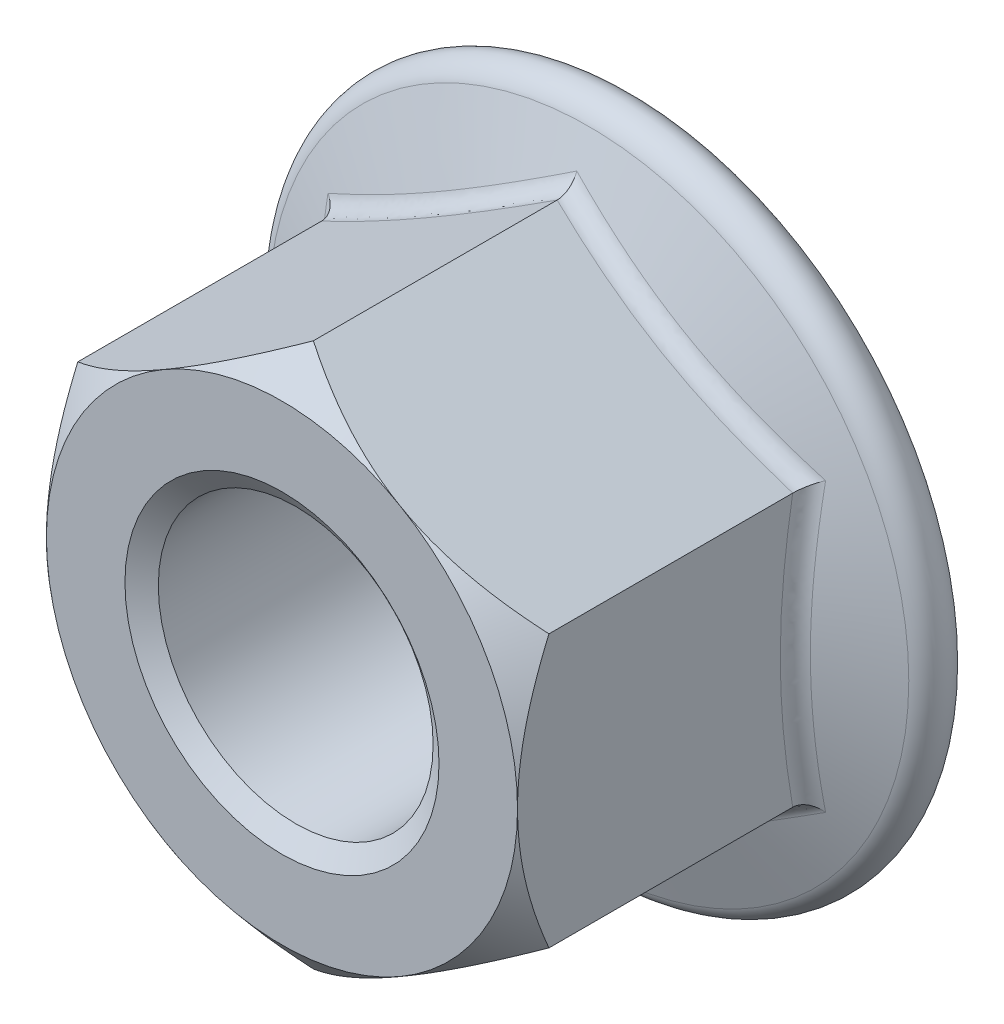
from build123d import *

# Parameters (mm, degrees)
BASENUT_START  = -22.5298
BASENUTSKE_R   = 8.75
BASENUT_DEPTH  = 22.5298
FLANGEFILLET_R = 1.2


# Read off the part's stored shape, not the designer's step: ThreadSchematic
with BuildPart() as part:
    # BaseNutSke → BaseNut (new body)
    with BuildSketch(Plane.XY.offset(BASENUT_START)):
        Polygon((15, 8.660254038), (15, -8.660254038), (0, -17.320508076), (-15, -8.660254038), (-15, 8.660254038), (0, 17.320508076), align=None)
        Circle(BASENUTSKE_R, mode=Mode.SUBTRACT)
    extrude(amount=BASENUT_DEPTH)

    # Sketch5 (on Right Plane) → EndChamfer (revolve, cut)
    with BuildSketch(Plane(origin=(0, 0, 0), x_dir=(0, 0, -1), z_dir=(1, 0, 0)), mode=Mode.PRIVATE) as endchamfer_sk:
        Polygon((22.5044, 10), (21.541614635, 8.625), (22.5552, 8.625), (22.5552, 10), align=None)
    revolve(endchamfer_sk.sketch.rotate(Axis((0, 0, -25.037505729), (0, 0, -1)), 90), axis=Axis((0, 0, -25.037505729), (0, 0, -1)), mode=Mode.SUBTRACT)

    # Sketch6 → Flange (revolve)
    with BuildSketch(Plane(origin=(0, 0, 0), x_dir=(0, 0, -1), z_dir=(1, 0, 0)), mode=Mode.PRIVATE) as flange_sk:
        with BuildLine():
            Line((15.29597298, 8.75), (19.5298, 20.382344136))
            ThreePointArc((19.5298, 20.382344136), (21.251733857, 21.376503112), (22.5298, 19.853363194))
            Line((22.5298, 19.853363194), (22.5298, 8.75))
            Line((22.5298, 8.75), (15.29597298, 8.75))
        make_face()
    revolve(flange_sk.sketch.rotate(Axis((0, 0, 0), (0, 0, -1)), 90), axis=Axis((0, 0, 0), (0, 0, -1)))

    # Sketch3 → Double-Chamfer (revolve, cut)
    with BuildSketch(Plane(origin=(0, 0, 0), x_dir=(0, 0, -1), z_dir=(1, 0, 0)), mode=Mode.PRIVATE) as double_chamfer_sk:
        Polygon((2, 30.020508076), (-12.7, 30.020508076), (-12.7, 15), (0, 15), (2, 17.320508076), align=None)
    revolve(double_chamfer_sk.sketch.rotate(Axis((0, 0, 0), (0, 0, -1)), 239.999999998), axis=Axis((0, 0, 0), (0, 0, -1)), mode=Mode.SUBTRACT)

    # FlangeFillet
    flangefillet_edges = [part.edges().sort_by_distance(p)[0] for p in [
        (7.5, 12.990381057, -17.570786944),
        (15, 4.349016441, -17.795627563),
        (-7.5, 12.990381057, -17.570786944),
        (-15, 0, -17.570786944),
        (-7.5, -12.990381057, -17.570786944),
        (7.5, -12.990381057, -17.570786944),
        (15, -4.349016441, -17.795627563),
    ]]
    fillet(flangefillet_edges, radius=FLANGEFILLET_R)

    # ThreadSchematic outline → ThreadSchematic (revolve, cut)
    with BuildSketch(Plane.XZ):
        Polygon((8.75, 0), (8.75, -0.875259423), (10, 0), align=None)
        Polygon((10, -22.5044), (8.75, -21.629140577), (8.75, -22.5298), (10, -22.5298), align=None)
    revolve(axis=Axis((0, 0, 0), (0, 0, 1)), mode=Mode.SUBTRACT)


solid = part.part
